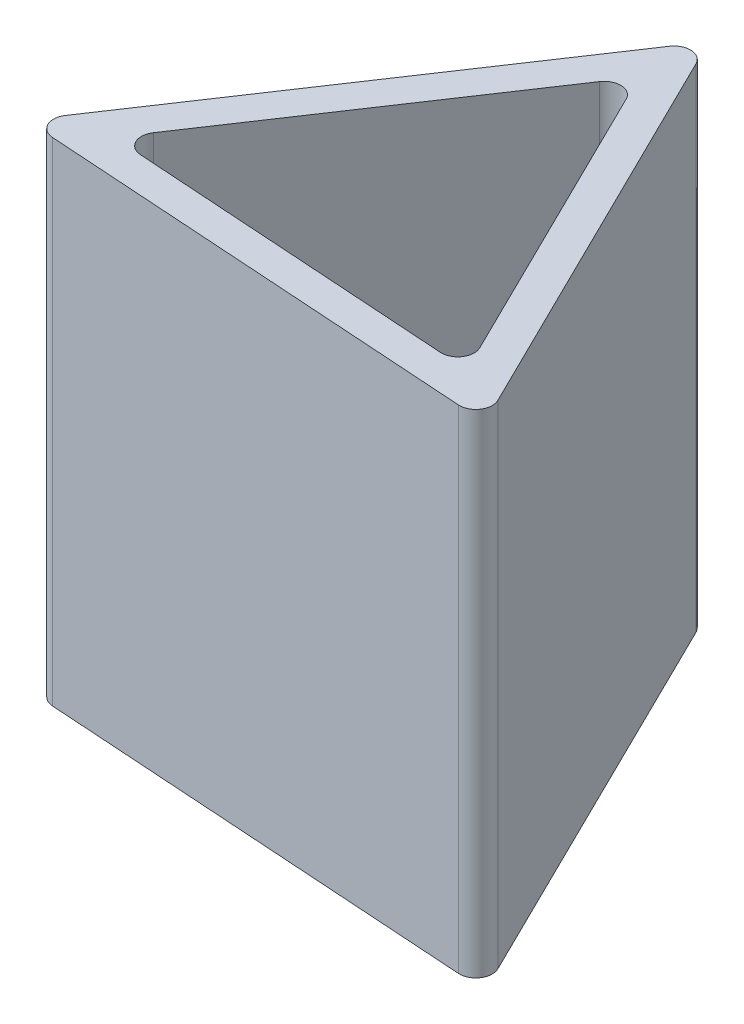
from build123d import *

# Parameters (mm, degrees)
BOSS_EXTRUDE1_DEPTH = 30
FILLET1_R           = 1


with BuildPart() as part:
    # Sketch1 → Boss-Extrude1 (new body)
    with BuildSketch(Plane(origin=(0, 0, 0), x_dir=(1, 0, 0), z_dir=(0, 1, 0))):
        Polygon((0, 17.282938314), (-16.6777552, -7.65403186), (13.257172065, -9.628906454), align=None)
        Polygon((-0.263316613, 13.291614679), (-13.089509231, -5.886408918), (9.932242708, -7.405205761), align=None, mode=Mode.SUBTRACT)
    extrude(amount=BOSS_EXTRUDE1_DEPTH)

    # Fillet1
    fillet1_edges = [part.edges().sort_by_distance(p)[0] for p in [
        (9.932242708, 15, 7.405205761),
        (-0.263316613, 15, -13.291614679),
        (-13.089509231, 15, 5.886408918),
        (-16.6777552, 15, 7.65403186),
        (13.257172065, 15, 9.628906454),
        (0, 15, -17.282938314),
    ]]
    fillet(fillet1_edges, radius=FILLET1_R)


solid = part.part
